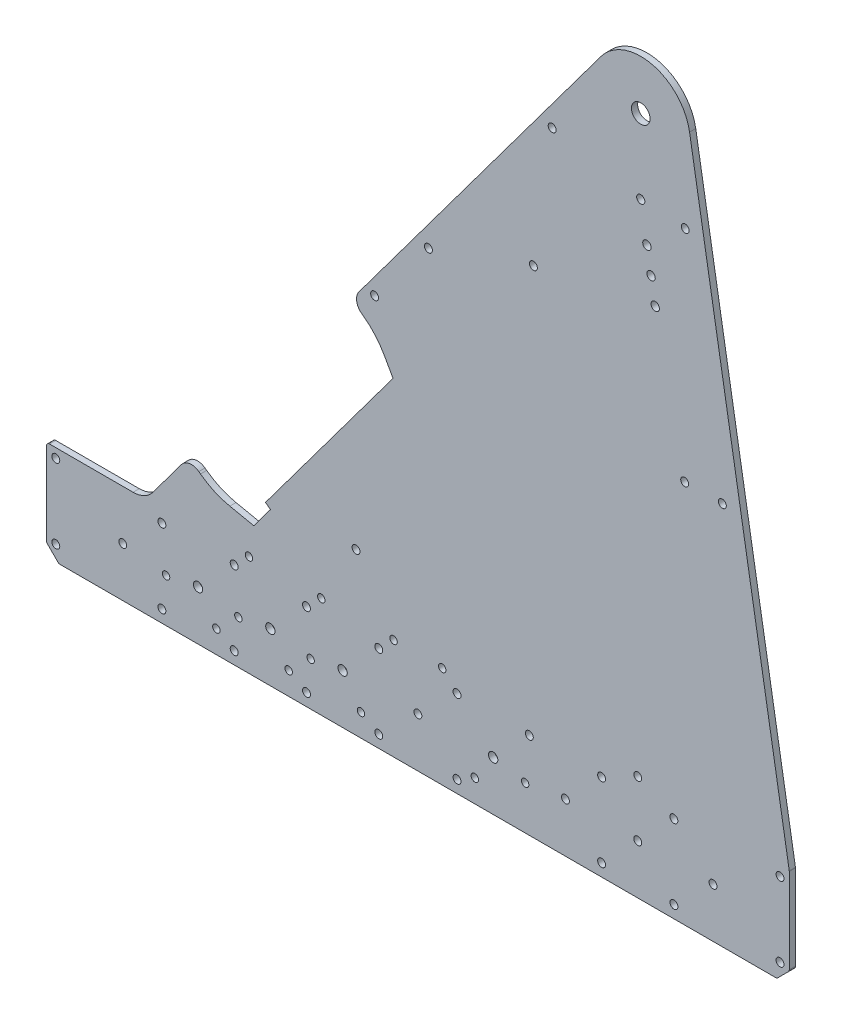
from build123d import *

# Parameters (mm, degrees)
BOSS_EXTRUDE1_DEPTH = 3.175
CUT_EXTRUDE1_REACH  = 536.354
SKETCH2_R           = 2.032
SKETCH5_R           = 2.032
SKETCH5_R_2         = 2.38125
CUT_EXTRUDE4_DEPTH  = 535.353537581
SKETCH6_R           = 2.032
CUT_EXTRUDE5_DEPTH  = 535.353537581
SKETCH3_R           = 4.7625
SKETCH3_R_2         = 2.032
SKETCH3_R_3         = 2.0955
SKETCH3_R_4         = 2.159
CUT_EXTRUDE2_DEPTH  = 535.353537581
FILLET1_R           = 1.5875
CUT_EXTRUDE3_REACH  = 536.354
SKETCH4_R           = 1.905
FILLET2_R           = 38.1
FILLET3_R           = 6.35


with BuildPart() as part:
    # Sketch1 → Boss-Extrude1 (new body)
    with BuildSketch(Plane.XY):
        with BuildLine():
            Line((0, 0), (381, 0))
            Line((381, 0), (381, 50.8))
            Line((381, 50.8), (329.844840527, 353.482725241))
            ThreePointArc((329.844840527, 353.482725241), (310.749161823, 373.943470262), (284.430621647, 364.423939024))
            Line((284.430621647, 364.423939024), (156.481664632, 192.666249))
            Line((156.481664632, 192.666249), (169.212526103, 183.18253711))
            Line((169.212526103, 183.18253711), (177.742147454, 168.059112986))
            Line((177.742147454, 168.059112986), (112.328856621, 80.248817439))
            Line((112.328856621, 80.248817439), (114.875028915, 78.352075061))
            Line((114.875028915, 78.352075061), (106.339688214, 66.894299738))
            Line((106.339688214, 66.894299738), (85.755861471, 71.150956167))
            Line((85.755861471, 71.150956167), (73.025, 80.634668057))
            Line((73.025, 80.634668057), (54.608894484, 55.913030488))
            ThreePointArc((54.608894484, 55.913030488), (50.122252657, 52.150010731), (44.424205307, 50.8))
            Line((44.424205307, 50.8), (0, 50.8))
            Line((0, 50.8), (0, 0))
        make_face()
    extrude(amount=BOSS_EXTRUDE1_DEPTH)

    # Sketch2 → Cut-Extrude1 (cut, up to next)
    with BuildSketch(Plane.XY.offset(3.175), mode=Mode.PRIVATE) as cut_extrude1_sk1:
        with Locations((4.7625, 46.0375)):
            Circle(SKETCH2_R)
    cut_extrude1_tool1 = extrude(cut_extrude1_sk1.sketch, amount=-CUT_EXTRUDE1_REACH, mode=Mode.PRIVATE) & part.part
    # Sketch2 → Cut-Extrude1 (cut, up to next)
    with BuildSketch(Plane.XY.offset(3.175), mode=Mode.PRIVATE) as cut_extrude1_sk2:
        with Locations((4.7625, 7.9375)):
            Circle(SKETCH2_R)
    cut_extrude1_tool2 = extrude(cut_extrude1_sk2.sketch, amount=-CUT_EXTRUDE1_REACH, mode=Mode.PRIVATE) & part.part
    # Sketch2 → Cut-Extrude1 (cut, up to next)
    with BuildSketch(Plane.XY.offset(3.175), mode=Mode.PRIVATE) as cut_extrude1_sk3:
        with Locations((376.2375, 7.9375)):
            Circle(SKETCH2_R)
    cut_extrude1_tool3 = extrude(cut_extrude1_sk3.sketch, amount=-CUT_EXTRUDE1_REACH, mode=Mode.PRIVATE) & part.part
    # Sketch2 → Cut-Extrude1 (cut, up to next)
    with BuildSketch(Plane.XY.offset(3.175), mode=Mode.PRIVATE) as cut_extrude1_sk4:
        with Locations((376.2375, 46.0375)):
            Circle(SKETCH2_R)
    cut_extrude1_tool4 = extrude(cut_extrude1_sk4.sketch, amount=-CUT_EXTRUDE1_REACH, mode=Mode.PRIVATE) & part.part
    # Sketch2 → Cut-Extrude1 (cut, up to next)
    with BuildSketch(Plane.XY.offset(3.175), mode=Mode.PRIVATE) as cut_extrude1_sk5:
        Polygon((0, 6.35), (0, 0), (6.35, 0), align=None)
    cut_extrude1_tool5 = extrude(cut_extrude1_sk5.sketch, amount=-CUT_EXTRUDE1_REACH, mode=Mode.PRIVATE) & part.part
    # Sketch2 → Cut-Extrude1 (cut, up to next)
    with BuildSketch(Plane.XY.offset(3.175), mode=Mode.PRIVATE) as cut_extrude1_sk6:
        Polygon((381, 0), (374.65, 0), (381, 6.35), align=None)
    cut_extrude1_tool6 = extrude(cut_extrude1_sk6.sketch, amount=-CUT_EXTRUDE1_REACH, mode=Mode.PRIVATE) & part.part
    add(cut_extrude1_tool1.solids().sort_by_distance((4.7625, 46.0375, 3.175))[0], mode=Mode.SUBTRACT)
    add(cut_extrude1_tool2.solids().sort_by_distance((4.7625, 7.9375, 3.175))[0], mode=Mode.SUBTRACT)
    add(cut_extrude1_tool3.solids().sort_by_distance((376.2375, 7.9375, 3.175))[0], mode=Mode.SUBTRACT)
    add(cut_extrude1_tool4.solids().sort_by_distance((376.2375, 46.0375, 3.175))[0], mode=Mode.SUBTRACT)
    add(cut_extrude1_tool5.solids().sort_by_distance((2.116667, 2.116667, 3.175))[0], mode=Mode.SUBTRACT)
    add(cut_extrude1_tool6.solids().sort_by_distance((378.883333, 2.116667, 3.175))[0], mode=Mode.SUBTRACT)

    # Sketch5 → Cut-Extrude4 (cut, through all)
    with BuildSketch(Plane.XY.offset(3.175)):
        with Locations((39.116, 25.4)):
            Circle(SKETCH5_R)
        with Locations((59.182, 6.35)):
            Circle(SKETCH5_R)
        with Locations((59.182, 44.45)):
            Circle(SKETCH5_R)
        with Locations((96.266, 44.45)):
            Circle(SKETCH5_R)
        with Locations((133.35, 44.45)):
            Circle(SKETCH5_R)
        with Locations((170.434, 44.45)):
            Circle(SKETCH5_R)
        with Locations((210.566, 44.45)):
            Circle(SKETCH5_R)
        with Locations((210.566, 6.35)):
            Circle(SKETCH5_R)
        with Locations((170.434, 6.35)):
            Circle(SKETCH5_R)
        with Locations((247.65, 44.45)):
            Circle(SKETCH5_R)
        with Locations((266.192, 25.4)):
            Circle(SKETCH5_R)
        with Locations((77.724, 25.4)):
            Circle(SKETCH5_R_2)
        with Locations((114.808, 25.4)):
            Circle(SKETCH5_R_2)
        with Locations((151.892, 25.4)):
            Circle(SKETCH5_R_2)
        with Locations((229.108, 25.4)):
            Circle(SKETCH5_R_2)
        with Locations((190.5, 25.4)):
            Circle(SKETCH5_R)
        with Locations((303.276, 25.4)):
            Circle(SKETCH5_R)
        with Locations((341.884, 25.4)):
            Circle(SKETCH5_R)
    extrude(amount=-CUT_EXTRUDE4_DEPTH, mode=Mode.SUBTRACT)

    # Sketch6 → Cut-Extrude5 (cut, through all)
    with BuildSketch(Plane.XY.offset(3.175)):
        with Locations((284.734, 44.45)):
            Circle(SKETCH6_R)
        with Locations((284.734, 6.35)):
            Circle(SKETCH6_R)
        with Locations((321.818, 6.35)):
            Circle(SKETCH6_R)
        with Locations((321.818, 44.45)):
            Circle(SKETCH6_R)
        with Locations((96.266, 6.35)):
            Circle(SKETCH6_R)
        with Locations((133.35, 6.35)):
            Circle(SKETCH6_R)
        with Locations((303.276, 53.975)):
            Circle(SKETCH6_R)
    extrude(amount=-CUT_EXTRUDE5_DEPTH, mode=Mode.SUBTRACT)

    # Sketch3 → Cut-Extrude2 (cut, through all)
    with BuildSketch(Plane.XY.offset(3.175)):
        with Locations((304.8, 349.25)):
            Circle(SKETCH3_R)
        with Locations((168.275, 200.025)):
            Circle(SKETCH3_R_2)
        with Locations((158.75, 82.55)):
            Circle(SKETCH3_R_2)
        with Locations((304.8, 311.15)):
            Circle(SKETCH3_R_3)
        with Locations((307.974543931, 292.366369605)):
            Circle(SKETCH3_R_4)
        with Locations((310.090906551, 279.843949341)):
            Circle(SKETCH3_R_4)
        with Locations((312.207269172, 267.321529077)):
            Circle(SKETCH3_R_4)
        with Locations((327.609354572, 309.551782373)):
            Circle(SKETCH3_R_2)
        with Locations((346.656618156, 196.85)):
            Circle(SKETCH3_R_2)
        with Locations((195.89872712, 234.95)):
            Circle(SKETCH3_R_2)
        with Locations((249.748290579, 254.09019371)):
            Circle(SKETCH3_R_2)
        with Locations((259.353431816, 320.131104669)):
            Circle(SKETCH3_R_2)
        with Locations((327.336471179, 196.85)):
            Circle(SKETCH3_R_2)
    extrude(amount=-CUT_EXTRUDE2_DEPTH, mode=Mode.SUBTRACT)

    # Fillet1
    fillet1_edges = [part.edges().sort_by_distance(p)[0] for p in [
        (374.65, 0, 1.5875),
        (381, 6.35, 1.5875),
        (381, 50.8, 1.5875),
        (6.35, 0, 1.5875),
        (0, 6.35, 1.5875),
        (0, 50.8, 1.5875),
    ]]
    fillet(fillet1_edges, radius=FILLET1_R)

    # Sketch4 → Cut-Extrude3 (cut, up to next)
    with BuildSketch(Plane(origin=(0, 0, 0), x_dir=(-1, 0, 0), z_dir=(0, 0, -1)), mode=Mode.PRIVATE) as cut_extrude3_sk1:
        with Locations((-61.318145625, 22.298133105)):
            Circle(SKETCH4_R)
    cut_extrude3_tool1 = extrude(cut_extrude3_sk1.sketch, amount=-CUT_EXTRUDE3_REACH, mode=Mode.PRIVATE) & part.part
    # Sketch4 → Cut-Extrude3 (cut, up to next)
    with BuildSketch(Plane(origin=(0, 0, 0), x_dir=(-1, 0, 0), z_dir=(0, 0, -1)), mode=Mode.PRIVATE) as cut_extrude3_sk2:
        with Locations((-87.131339764, 11.605958005)):
            Circle(SKETCH4_R)
    cut_extrude3_tool2 = extrude(cut_extrude3_sk2.sketch, amount=-CUT_EXTRUDE3_REACH, mode=Mode.PRIVATE) & part.part
    # Sketch4 → Cut-Extrude3 (cut, up to next)
    with BuildSketch(Plane(origin=(0, 0, 0), x_dir=(-1, 0, 0), z_dir=(0, 0, -1)), mode=Mode.PRIVATE) as cut_extrude3_sk3:
        with Locations((-98.402145625, 22.298133105)):
            Circle(SKETCH4_R)
    cut_extrude3_tool3 = extrude(cut_extrude3_sk3.sketch, amount=-CUT_EXTRUDE3_REACH, mode=Mode.PRIVATE) & part.part
    # Sketch4 → Cut-Extrude3 (cut, up to next)
    with BuildSketch(Plane(origin=(0, 0, 0), x_dir=(-1, 0, 0), z_dir=(0, 0, -1)), mode=Mode.PRIVATE) as cut_extrude3_sk4:
        with Locations((-124.215339764, 11.605958005)):
            Circle(SKETCH4_R)
    cut_extrude3_tool4 = extrude(cut_extrude3_sk4.sketch, amount=-CUT_EXTRUDE3_REACH, mode=Mode.PRIVATE) & part.part
    # Sketch4 → Cut-Extrude3 (cut, up to next)
    with BuildSketch(Plane(origin=(0, 0, 0), x_dir=(-1, 0, 0), z_dir=(0, 0, -1)), mode=Mode.PRIVATE) as cut_extrude3_sk5:
        with Locations((-135.486145625, 22.298133105)):
            Circle(SKETCH4_R)
    cut_extrude3_tool5 = extrude(cut_extrude3_sk5.sketch, amount=-CUT_EXTRUDE3_REACH, mode=Mode.PRIVATE) & part.part
    # Sketch4 → Cut-Extrude3 (cut, up to next)
    with BuildSketch(Plane(origin=(0, 0, 0), x_dir=(-1, 0, 0), z_dir=(0, 0, -1)), mode=Mode.PRIVATE) as cut_extrude3_sk6:
        with Locations((-161.299339764, 11.605958005)):
            Circle(SKETCH4_R)
    cut_extrude3_tool6 = extrude(cut_extrude3_sk6.sketch, amount=-CUT_EXTRUDE3_REACH, mode=Mode.PRIVATE) & part.part
    # Sketch4 → Cut-Extrude3 (cut, up to next)
    with BuildSketch(Plane(origin=(0, 0, 0), x_dir=(-1, 0, 0), z_dir=(0, 0, -1)), mode=Mode.PRIVATE) as cut_extrude3_sk7:
        with Locations((-245.513854375, 22.298133105)):
            Circle(SKETCH4_R)
    cut_extrude3_tool7 = extrude(cut_extrude3_sk7.sketch, amount=-CUT_EXTRUDE3_REACH, mode=Mode.PRIVATE) & part.part
    # Sketch4 → Cut-Extrude3 (cut, up to next)
    with BuildSketch(Plane(origin=(0, 0, 0), x_dir=(-1, 0, 0), z_dir=(0, 0, -1)), mode=Mode.PRIVATE) as cut_extrude3_sk8:
        with Locations((-219.700660236, 11.605958005)):
            Circle(SKETCH4_R)
    cut_extrude3_tool8 = extrude(cut_extrude3_sk8.sketch, amount=-CUT_EXTRUDE3_REACH, mode=Mode.PRIVATE) & part.part
    # Sketch4 → Cut-Extrude3 (cut, up to next)
    with BuildSketch(Plane(origin=(0, 0, 0), x_dir=(-1, 0, 0), z_dir=(0, 0, -1)), mode=Mode.PRIVATE) as cut_extrude3_sk9:
        with Locations((-202.981986443, 51.968407021)):
            Circle(SKETCH4_R)
    cut_extrude3_tool9 = extrude(cut_extrude3_sk9.sketch, amount=-CUT_EXTRUDE3_REACH, mode=Mode.PRIVATE) & part.part
    # Sketch4 → Cut-Extrude3 (cut, up to next)
    with BuildSketch(Plane(origin=(0, 0, 0), x_dir=(-1, 0, 0), z_dir=(0, 0, -1)), mode=Mode.PRIVATE) as cut_extrude3_sk10:
        with Locations((-178.018013557, 51.968407021)):
            Circle(SKETCH4_R)
    cut_extrude3_tool10 = extrude(cut_extrude3_sk10.sketch, amount=-CUT_EXTRUDE3_REACH, mode=Mode.PRIVATE) & part.part
    # Sketch4 → Cut-Extrude3 (cut, up to next)
    with BuildSketch(Plane(origin=(0, 0, 0), x_dir=(-1, 0, 0), z_dir=(0, 0, -1)), mode=Mode.PRIVATE) as cut_extrude3_sk11:
        with Locations((-140.934013557, 51.968407021)):
            Circle(SKETCH4_R)
    cut_extrude3_tool11 = extrude(cut_extrude3_sk11.sketch, amount=-CUT_EXTRUDE3_REACH, mode=Mode.PRIVATE) & part.part
    # Sketch4 → Cut-Extrude3 (cut, up to next)
    with BuildSketch(Plane(origin=(0, 0, 0), x_dir=(-1, 0, 0), z_dir=(0, 0, -1)), mode=Mode.PRIVATE) as cut_extrude3_sk12:
        with Locations((-103.850013557, 51.968407021)):
            Circle(SKETCH4_R)
    cut_extrude3_tool12 = extrude(cut_extrude3_sk12.sketch, amount=-CUT_EXTRUDE3_REACH, mode=Mode.PRIVATE) & part.part
    add(cut_extrude3_tool1.solids().sort_by_distance((61.318146, 22.298133, 0))[0], mode=Mode.SUBTRACT)
    add(cut_extrude3_tool2.solids().sort_by_distance((87.13134, 11.605958, 0))[0], mode=Mode.SUBTRACT)
    add(cut_extrude3_tool3.solids().sort_by_distance((98.402146, 22.298133, 0))[0], mode=Mode.SUBTRACT)
    add(cut_extrude3_tool4.solids().sort_by_distance((124.21534, 11.605958, 0))[0], mode=Mode.SUBTRACT)
    add(cut_extrude3_tool5.solids().sort_by_distance((135.486146, 22.298133, 0))[0], mode=Mode.SUBTRACT)
    add(cut_extrude3_tool6.solids().sort_by_distance((161.29934, 11.605958, 0))[0], mode=Mode.SUBTRACT)
    add(cut_extrude3_tool7.solids().sort_by_distance((245.513854, 22.298133, 0))[0], mode=Mode.SUBTRACT)
    add(cut_extrude3_tool8.solids().sort_by_distance((219.70066, 11.605958, 0))[0], mode=Mode.SUBTRACT)
    add(cut_extrude3_tool9.solids().sort_by_distance((202.981986, 51.968407, 0))[0], mode=Mode.SUBTRACT)
    add(cut_extrude3_tool10.solids().sort_by_distance((178.018014, 51.968407, 0))[0], mode=Mode.SUBTRACT)
    add(cut_extrude3_tool11.solids().sort_by_distance((140.934014, 51.968407, 0))[0], mode=Mode.SUBTRACT)
    add(cut_extrude3_tool12.solids().sort_by_distance((103.850014, 51.968407, 0))[0], mode=Mode.SUBTRACT)

    # Fillet2
    fillet2_edges = [part.edges().sort_by_distance(p)[0] for p in [
        (85.755861471, 71.150956167, 1.5875),
        (169.212526103, 183.18253711, 1.5875),
    ]]
    fillet(fillet2_edges, radius=FILLET2_R)

    # Fillet3
    fillet3_edges = [part.edges().sort_by_distance(p)[0] for p in [
        (73.025, 80.634668057, 1.5875),
        (156.481664632, 192.666249, 1.5875),
    ]]
    fillet(fillet3_edges, radius=FILLET3_R)


solid = part.part
